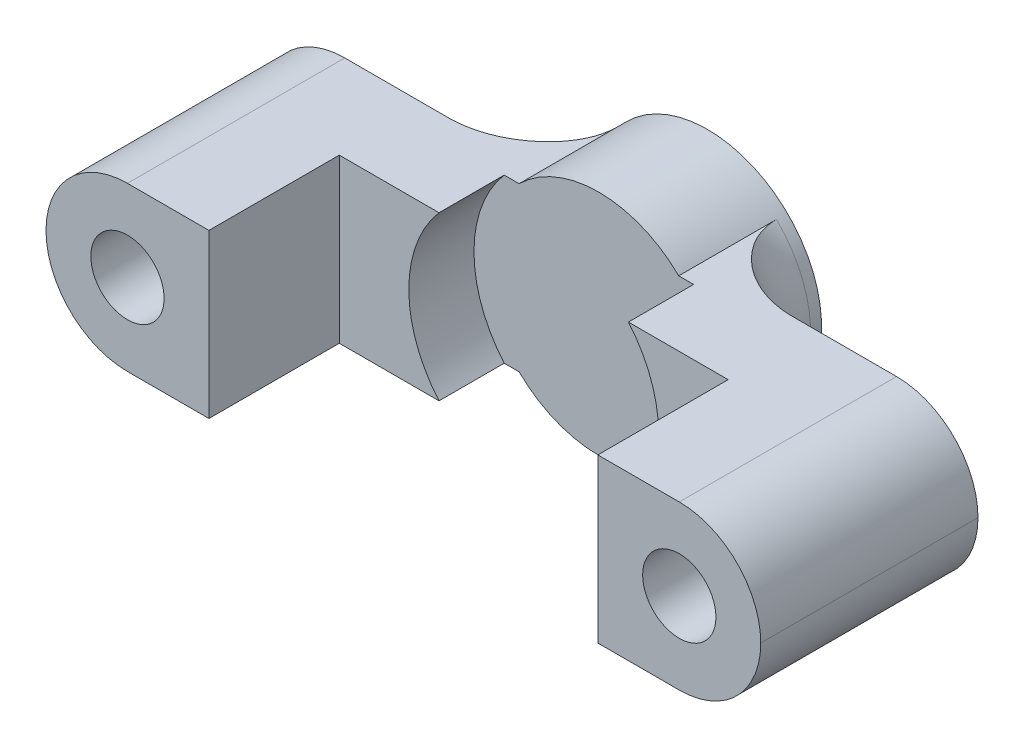
from build123d import *
from build123d.topology import SkipClean

# Parameters (mm, degrees)
SKETCH1_R             = 3.3734375
BOSS_EXTRUDE1_DEPTH   = 6
BOSS_EXTRUDE1_2_DEPTH = 6
BOSS_EXTRUDE2_START   = 2
SKETCH2_R             = 3.3734375
BOSS_EXTRUDE2_DEPTH   = 2
SKETCH3_R             = 10.5
BOSS_EXTRUDE3_DEPTH   = 2
BOSS_EXTRUDE4_START   = 2
SKETCH4_R             = 10.5
BOSS_EXTRUDE4_DEPTH   = 2
BOSS_EXTRUDE5_START   = 6
SKETCH5_R             = 10.5
SKETCH5_R_2           = 1.5
BOSS_EXTRUDE5_DEPTH   = 6
FILLET1_R             = 7
SKETCH6_W             = 15
SKETCH6_H             = 15
SKETCH6_R             = 3.3734375
BOSS_EXTRUDE6_DEPTH   = 12
SKETCH7_R             = 5.5
CUT_EXTRUDE2_DEPTH    = 15
SKETCH8_W             = 8
SKETCH8_H             = 15
CUT_EXTRUDE3_DEPTH    = 5.2
SKETCH9_W             = 8
SKETCH9_H             = 15
CUT_EXTRUDE4_DEPTH    = 5.2
FILLET2_R             = 7.5


# Some blends are built 0.0001 mm under size
with BuildPart() as part:
    # Sketch1 → Boss-Extrude1 (new body)
    with BuildSketch(Plane.XY):
        with BuildLine():
            ThreePointArc((11.5, 0), (10.782037741, -3.999707758), (8.717797887, -7.5))
            Line((8.717797887, -7.5), (38.1, -7.5))
            Line((38.1, -7.5), (38.1, 7.5))
            Line((38.1, 7.5), (8.717797887, 7.5))
            ThreePointArc((8.717797887, 7.5), (10.782037741, 3.999707758), (11.5, 0))
        make_face()
        with Locations((25.4, 0)):
            Circle(SKETCH1_R, mode=Mode.SUBTRACT)
    extrude(amount=BOSS_EXTRUDE1_DEPTH)



with BuildPart() as body_2:
    # Sketch1 → Boss-Extrude1 2 (new body)
    with BuildSketch(Plane.XY):
        with BuildLine():
            Line((-38.1, 7.5), (-38.1, -7.5))
            Line((-38.1, -7.5), (-8.717797887, -7.5))
            ThreePointArc((-8.717797887, -7.5), (-11.5, 0), (-8.717797887, 7.5))
            Line((-8.717797887, 7.5), (-38.1, 7.5))
        make_face()
        with Locations((-25.4, 0)):
            Circle(SKETCH1_R, mode=Mode.SUBTRACT)
    extrude(amount=BOSS_EXTRUDE1_2_DEPTH)


with BuildPart() as part_1:
    with SkipClean():  # the faces are left unmerged after this step: merging them gives an invalid solid
        add(part.part)

        add(body_2.part)  # Boss-Extrude2 merges body 2
        # Sketch2 → Boss-Extrude2 (add)
        # profile 1 of 3: a face of its own
        with BuildSketch(Plane(origin=(0, 0, 0), x_dir=(-1, 0, 0), z_dir=(0, 0, -1)).offset(BOSS_EXTRUDE2_START)):
            with BuildLine():
                Line((-38.1, -7.5), (-8.717797887, -7.5))
                ThreePointArc((-8.717797887, -7.5), (-11.5, 0), (-8.717797887, 7.5))
                Line((-8.717797887, 7.5), (-38.1, 7.5))
                Line((-38.1, 7.5), (-38.1, -7.5))
            make_face()
            with Locations((-25.4, 0)):
                Circle(SKETCH2_R, mode=Mode.SUBTRACT)
        # profile 2 of 3: a face of its own
        with BuildSketch(Plane(origin=(0, 0, 0), x_dir=(-1, 0, 0), z_dir=(0, 0, -1)).offset(BOSS_EXTRUDE2_START)):
            with BuildLine():
                Line((-8.717797887, -7.5), (8.717797887, -7.5))
                ThreePointArc((8.717797887, -7.5), (11.5, 0), (8.717797887, 7.5))
                Line((8.717797887, 7.5), (-8.717797887, 7.5))
                ThreePointArc((-8.717797887, 7.5), (-11.5, 0), (-8.717797887, -7.5))
            make_face()
        # profile 3 of 3: a face of its own
        with BuildSketch(Plane(origin=(0, 0, 0), x_dir=(-1, 0, 0), z_dir=(0, 0, -1)).offset(BOSS_EXTRUDE2_START)):
            with BuildLine():
                ThreePointArc((8.717797887, -7.5), (11.5, 0), (8.717797887, 7.5))
                Line((8.717797887, 7.5), (38.1, 7.5))
                Line((38.1, 7.5), (38.1, -7.5))
                Line((38.1, -7.5), (8.717797887, -7.5))
            make_face()
            with Locations(Location((25.4, 0, 0), (0, 0, 180))):
                Circle(SKETCH2_R, mode=Mode.SUBTRACT)
        extrude(amount=-BOSS_EXTRUDE2_DEPTH)

    # Sketch3 → Boss-Extrude3 (add)
    with SkipClean():  # the faces are left unmerged after this step: merging them gives an invalid solid
        with BuildSketch(Plane(origin=(0, 0, -2), x_dir=(-1, 0, 0), z_dir=(0, 0, -1))):
            Circle(SKETCH3_R)
        extrude(amount=-BOSS_EXTRUDE3_DEPTH)

    # Sketch4 → Boss-Extrude4 (add)
    with SkipClean():  # the faces are left unmerged after this step: merging them gives an invalid solid
        with BuildSketch(Plane(origin=(0, 0, -2), x_dir=(-1, 0, 0), z_dir=(0, 0, -1)).offset(BOSS_EXTRUDE4_START)):
            Circle(SKETCH4_R)
        extrude(amount=-BOSS_EXTRUDE4_DEPTH)

    # Sketch5 → Boss-Extrude5 (add)
    with SkipClean():  # the faces are left unmerged after this step: merging them gives an invalid solid
        with BuildSketch(Plane(origin=(0, 0, -4), x_dir=(-1, 0, 0), z_dir=(0, 0, -1)).offset(BOSS_EXTRUDE5_START)):
            Circle(SKETCH5_R)
            Circle(SKETCH5_R_2, mode=Mode.SUBTRACT)
        extrude(amount=-BOSS_EXTRUDE5_DEPTH)

    # Fillet1
    # the kernel refuses this fillet: 7 mm, written as the material it adds along each edge
    with BuildSketch(Plane(origin=(0, 0, -2), x_dir=(-1, 0, 0), z_dir=(0, -1, 0))) as fillet1_piece_1_section:
        with BuildLine():
            CenterArc((10.5 + FILLET1_R, FILLET1_R), FILLET1_R, 180, 90)
            Line((10.5 + FILLET1_R, 0), (10.5, 0))
            Line((10.5, 0), (10.5, FILLET1_R))
        make_face()
    fillet1_piece_1 = revolve(axis=Axis((0, 0, -2), (0, 0, -1)), revolution_arc=141.087496106, mode=Mode.PRIVATE)
    fillet1_piece_1 = split(fillet1_piece_1, bisect_by=Plane(origin=(-11.14561096, 7.5, -3.604307229), z_dir=(0, -1, 0)), keep=Keep.TOP, mode=Mode.PRIVATE)
    add(fillet1_piece_1)
    with BuildSketch(Plane(origin=(0, 0, -2), x_dir=(-0.7784296665775441, 0.627731833024241, 0), z_dir=(-0.627731833024241, -0.7784296665775441, 0))) as fillet1_piece_2_section:
        with BuildLine():
            CenterArc((10.5 + FILLET1_R, FILLET1_R), FILLET1_R, 180, 90)
            Line((10.5, FILLET1_R), (10.5, 0))
            Line((10.5, 0), (10.5 + FILLET1_R, 0))
        make_face()
    fillet1_piece_2 = revolve(axis=Axis((0, 0, -2), (0, 0, -1)), revolution_arc=282.234042337, mode=Mode.PRIVATE)
    fillet1_piece_2 = split(fillet1_piece_2, bisect_by=Plane(origin=(-8.090689078, 7.5, -4.608700721), z_dir=(0, -1, 0)), keep=Keep.TOP, mode=Mode.PRIVATE)
    fillet1_piece_2 = split(fillet1_piece_2, bisect_by=Plane(origin=(-8.090689078, -7.5, -4.608700721), z_dir=(0, 1, 0)), keep=Keep.TOP, mode=Mode.PRIVATE)
    add(fillet1_piece_2)
    with BuildSketch(Plane(origin=(0, 0, -2), x_dir=(0.7781060870335762, -0.6281328818978487, 0), z_dir=(0.6281328818978487, 0.7781060870335762, 0))) as fillet1_piece_3_section:
        with BuildLine():
            CenterArc((10.5 + FILLET1_R, FILLET1_R), FILLET1_R, 180, 90)
            Line((10.5 + FILLET1_R, 0), (10.5, 0))
            Line((10.5, 0), (10.5, FILLET1_R))
        make_face()
    fillet1_piece_3 = revolve(axis=Axis((0, 0, -2), (0, 0, -1)), revolution_arc=141.087496106, mode=Mode.PRIVATE)
    fillet1_piece_3 = split(fillet1_piece_3, bisect_by=Plane(origin=(8.086917583, -7.5, -4.611323589), z_dir=(0, 1, 0)), keep=Keep.TOP, mode=Mode.PRIVATE)
    add(fillet1_piece_3)

    # Sketch6 → Boss-Extrude6 (add)
    with BuildSketch(Plane.XY.offset(6)):
        with Locations((25.4, 0)):
            Rectangle(SKETCH6_W, SKETCH6_H)
        with Locations(Location((25.4, 0, 0), (0, 0, 180))):
            Circle(SKETCH6_R, mode=Mode.SUBTRACT)
    boss_extrude6 = extrude(amount=BOSS_EXTRUDE6_DEPTH)

    # Sketch7 → Cut-Extrude2 (cut)
    with BuildSketch(Plane(origin=(0, 0, -2), x_dir=(-1, 0, 0), z_dir=(0, 0, -1))):
        with Locations((-25.4, 0)):
            Circle(SKETCH7_R)
    cut_extrude2 = extrude(amount=-CUT_EXTRUDE2_DEPTH, mode=Mode.SUBTRACT)

    # Sketch8 → Cut-Extrude3 (cut)
    with BuildSketch(Plane(origin=(38.1, 0, 0), x_dir=(0, 0, -1), z_dir=(1, 0, 0))):
        with Locations((-2, 0)):
            Rectangle(SKETCH8_W, SKETCH8_H)
    extrude(amount=-CUT_EXTRUDE3_DEPTH, mode=Mode.SUBTRACT)

    # Mirror1: Boss-Extrude6, Cut-Extrude2 across plane
    add(boss_extrude6.mirror(Plane(origin=(0, 0, 0), x_dir=(0, 0, 1), z_dir=(1, 0, 0))))
    add(cut_extrude2.mirror(Plane(origin=(0, 0, 0), x_dir=(0, 0, 1), z_dir=(1, 0, 0))), mode=Mode.SUBTRACT)

    # Sketch9 → Cut-Extrude4 (cut)
    with BuildSketch(Plane.ZY.offset(38.1)):
        with Locations((2, 0)):
            Rectangle(SKETCH9_W, SKETCH9_H)
    extrude(amount=-CUT_EXTRUDE4_DEPTH, mode=Mode.SUBTRACT)

    # Fillet2
    fillet2_edges = [part_1.edges().sort_by_distance(p)[0] for p in [
        (32.9, -7.5, 8),
        (32.9, 7.5, 8),
        (-32.9, 7.5, 8),
        (-32.9, -7.5, 8),
    ]]
    fillet(fillet2_edges, radius=FILLET2_R - 0.0001)  # a hair under: the kernel refuses the full size


solid = part_1.part
